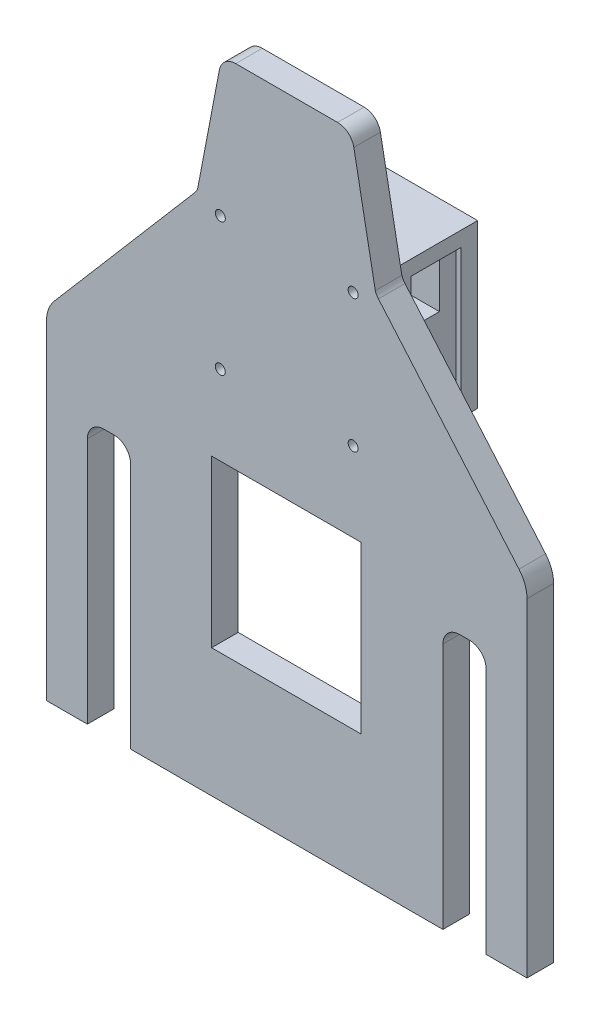
from build123d import *

# Parameters (mm, degrees)
BOSS_EXTRUDE1_DEPTH    = 8
SKETCH2_W              = 45
SKETCH2_H              = 50
CUT_EXTRUDE1_DEPTH     = 342.206659287
SPLIT1_SURFACE_1_BACK  = 343.199
SPLIT1_SURFACE_1_DEPTH = 686.398
SPLIT1_SURFACE_2_BACK  = 343.199
SPLIT1_SURFACE_2_DEPTH = 686.398
SKETCH5_R              = 2.5
CUT_EXTRUDE6_DEPTH     = 5.2
SKETCH4_R              = 2.5
CUT_EXTRUDE7_DEPTH     = 10
SKETCH6_R              = 1.5
CUT_EXTRUDE8_DEPTH     = 342.206659287
SKETCH7_W              = 49
SKETCH7_H              = 49
SKETCH7_W_2            = 18
SKETCH7_H_2            = 18
BOSS_EXTRUDE2_DEPTH    = 15
SKETCH8_W              = 49
SKETCH8_H              = 49
SKETCH8_R              = 1.5
BOSS_EXTRUDE3_DEPTH    = 10
SKETCH9_W              = 15
SKETCH9_H              = 40
CUT_EXTRUDE9_DEPTH     = 1.5
SKETCH11_W             = 15
SKETCH11_H             = 40
CUT_EXTRUDE10_DEPTH    = 1.5


with BuildPart() as part:
    # Sketch1 → Boss-Extrude1 (new body)
    with BuildSketch(Plane.XY):
        with BuildLine():
            Line((70, 309.985818768), (85.299227191, 309.985818768))
            ThreePointArc((85.299227191, 309.985818768), (88.489017574, 308.836174247), (90.211957942, 305.915913694))
            Line((90.211957942, 305.915913694), (96.672728921, 271.790334282))
            ThreePointArc((96.672728921, 271.790334282), (97.06575438, 270.906904614), (97.621470019, 270.115641625))
            Line((97.621470019, 270.115641625), (139.950460317, 220.786053348))
            ThreePointArc((139.950460317, 220.786053348), (141.739336996, 217.746026552), (142.361429131, 214.274017901))
            Line((142.361429131, 214.274017901), (142.361429131, 30.859943174))
            ThreePointArc((142.361429131, 30.859943174), (140.896963037, 27.324409268), (137.361429131, 25.859943174))
            Line((137.361429131, 25.859943174), (114.717190871, 25.782318449))
            ThreePointArc((114.717190871, 25.782318449), (112.681998989, 25.341726514), (111.002773989, 24.110332733))
            Line((111.002773989, 24.110332733), (89.38285929, 0))
            Line((89.38285929, 0), (50.5, 0))
            Line((50.5, 0), (28.997226011, 24.110332733))
            ThreePointArc((28.997226011, 24.110332733), (27.318001011, 25.341726514), (25.282809129, 25.782318449))
            Line((25.282809129, 25.782318449), (2.638570869, 25.859943174))
            ThreePointArc((2.638570869, 25.859943174), (-0.896963037, 27.324409268), (-2.361429131, 30.859943174))
            Line((-2.361429131, 30.859943174), (-2.361429131, 214.274017901))
            ThreePointArc((-2.361429131, 214.274017901), (-1.739336996, 217.746026552), (0.049539683, 220.786053348))
            Line((0.049539683, 220.786053348), (42.261389271, 270.115641625))
            ThreePointArc((42.261389271, 270.115641625), (42.81710491, 270.906904614), (43.210130369, 271.790334282))
            Line((43.210130369, 271.790334282), (49.724618218, 305.923183314))
            ThreePointArc((49.724618218, 305.923183314), (51.449026762, 308.838533573), (54.635967087, 309.985818768))
            Line((54.635967087, 309.985818768), (70, 309.985818768))
        make_face()
        with BuildLine():
            Line((15.218798766, 54.807228462), (17.702103505, 54.807228462))
            ThreePointArc((17.702103505, 54.807228462), (21.420312934, 56.347361236), (22.960445707, 60.065570665))
            Line((22.960445707, 60.065570665), (22.960445707, 189.807228462))
            ThreePointArc((22.960445707, 189.807228462), (21.495979613, 193.342762368), (17.960445707, 194.807228462))
            Line((17.960445707, 194.807228462), (14.960456564, 194.807228462))
            ThreePointArc((14.960456564, 194.807228462), (11.424922658, 193.342762368), (9.960456564, 189.807228462))
            Line((9.960456564, 189.807228462), (9.960456564, 60.065570665))
            ThreePointArc((9.960456564, 60.065570665), (11.500589337, 56.347361236), (15.218798766, 54.807228462))
        make_face(mode=Mode.SUBTRACT)
        with BuildLine():
            Line((125.039543436, 54.807228462), (122.039554293, 54.807228462))
            ThreePointArc((122.039554293, 54.807228462), (118.504020387, 56.271694556), (117.039554293, 59.807228462))
            Line((117.039554293, 59.807228462), (117.039554293, 189.807228462))
            ThreePointArc((117.039554293, 189.807228462), (118.504020387, 193.342762368), (122.039554293, 194.807228462))
            Line((122.039554293, 194.807228462), (125.039543436, 194.807228462))
            ThreePointArc((125.039543436, 194.807228462), (128.575077342, 193.342762368), (130.039543436, 189.807228462))
            Line((130.039543436, 189.807228462), (130.039543436, 59.807228462))
            ThreePointArc((130.039543436, 59.807228462), (128.575077342, 56.271694556), (125.039543436, 54.807228462))
        make_face(mode=Mode.SUBTRACT)
    extrude(amount=BOSS_EXTRUDE1_DEPTH)

    # Sketch2 → Cut-Extrude1 (cut, through all)
    with BuildSketch(Plane.XY.offset(8)):
        with Locations((69.88285929, 179.008918923)):
            Rectangle(SKETCH2_W, SKETCH2_H)
    extrude(amount=-CUT_EXTRUDE1_DEPTH, mode=Mode.SUBTRACT)


with BuildPart() as body_2:
    # Split1: the piece behind the surface
    add(part.part)
    # Split1 surface: a surface, the sketch's curves swept straight by 686.398 mm
    with BuildLine(Plane(origin=(0, 0, 0), x_dir=(-1, 0, 0), z_dir=(0, 0, -1)).offset(-SPLIT1_SURFACE_1_BACK), mode=Mode.PRIVATE) as split1_surface_1_path:
        Line((-142.361429131, 115.359943174), (2.361429131, 115.359943174))
    split1_surface_1 = Shell.extrude(split1_surface_1_path.wire(), (0 * SPLIT1_SURFACE_1_DEPTH, 0 * SPLIT1_SURFACE_1_DEPTH, -1 * SPLIT1_SURFACE_1_DEPTH))
    split(bisect_by=split1_surface_1, keep=Keep.BOTTOM)

    # Sketch5 → Cut-Extrude6 (cut)
    with BuildSketch(Plane(origin=(0, 115.359943174, -115.359943174), x_dir=(1, 0, 0), z_dir=(0, -1, 0))):
        with Locations((70, 119.359943174)):
            Circle(SKETCH5_R)
        with Locations((40, 119.359943174)):
            Circle(SKETCH5_R)
        with Locations((2.638570869, 119.359943174)):
            Circle(SKETCH5_R)
    extrude(amount=CUT_EXTRUDE6_DEPTH, mode=Mode.SUBTRACT)


with BuildPart() as part_1:
    add(part.part)

    # Split1: split by a surface, the side it looks to stays
    # Split1 surface: a surface, the sketch's curves swept straight by 686.398 mm
    with BuildLine(Plane(origin=(0, 0, 0), x_dir=(-1, 0, 0), z_dir=(0, 0, -1)).offset(-SPLIT1_SURFACE_2_BACK), mode=Mode.PRIVATE) as split1_surface_2_path:
        Line((-142.361429131, 115.359943174), (2.361429131, 115.359943174))
    split1_surface_2 = Shell.extrude(split1_surface_2_path.wire(), (0 * SPLIT1_SURFACE_2_DEPTH, 0 * SPLIT1_SURFACE_2_DEPTH, -1 * SPLIT1_SURFACE_2_DEPTH))
    split(bisect_by=split1_surface_2, keep=Keep.TOP)

    # Sketch4 → Cut-Extrude7 (cut)
    with BuildSketch(Plane(origin=(0, 115.359943174, 0), x_dir=(-1, 0, 0), z_dir=(0, -1, 0))):
        with Locations((-70, -4)):
            Circle(SKETCH4_R)
        with Locations((-40, -4)):
            Circle(SKETCH4_R)
        with Locations((-100, -4)):
            Circle(SKETCH4_R)
        with Locations((-137.361429131, -4)):
            Circle(SKETCH4_R)
        with Locations((-3.799513716, -4)):
            Circle(SKETCH4_R)
    extrude(amount=-CUT_EXTRUDE7_DEPTH, mode=Mode.SUBTRACT)

    # Sketch6 → Cut-Extrude8 (cut, through all)
    with BuildSketch(Plane.XY.offset(8)):
        with Locations((50.000130369, 267.980334282)):
            Circle(SKETCH6_R)
        with Locations((90.000130369, 267.980334282)):
            Circle(SKETCH6_R)
        with Locations((90.000130369, 227.980334282)):
            Circle(SKETCH6_R)
        with Locations((50.000130369, 227.980334282)):
            Circle(SKETCH6_R)
    extrude(amount=-CUT_EXTRUDE8_DEPTH, mode=Mode.SUBTRACT)

    # Sketch7 → Boss-Extrude2 (add)
    with BuildSketch(Plane(origin=(0, 0, 0), x_dir=(-1, 0, 0), z_dir=(0, 0, -1))):
        with Locations((-70.000130369, 247.980334282)):
            Rectangle(SKETCH7_W, SKETCH7_H)
        with Locations((-56.000130369, 261.980334282)):
            Rectangle(SKETCH7_W_2, SKETCH7_H_2, mode=Mode.SUBTRACT)
        with Locations((-84.000130369, 261.980334282)):
            Rectangle(SKETCH7_W_2, SKETCH7_H_2, mode=Mode.SUBTRACT)
        with Locations((-84.000130369, 233.980334282)):
            Rectangle(SKETCH7_W_2, SKETCH7_H_2, mode=Mode.SUBTRACT)
        with Locations((-56.000130369, 233.980334282)):
            Rectangle(SKETCH7_W_2, SKETCH7_H_2, mode=Mode.SUBTRACT)
    extrude(amount=BOSS_EXTRUDE2_DEPTH)

    # Sketch8 → Boss-Extrude3 (add)
    with BuildSketch(Plane(origin=(0, 0, -15), x_dir=(-1, 0, 0), z_dir=(0, 0, -1))):
        with Locations((-70.000130369, 247.980334282)):
            Rectangle(SKETCH8_W, SKETCH8_H)
        with Locations((-50.000130369, 267.980334282)):
            Circle(SKETCH8_R, mode=Mode.SUBTRACT)
        with Locations((-90.000130369, 267.980334282)):
            Circle(SKETCH8_R, mode=Mode.SUBTRACT)
        with Locations((-50.000130369, 227.980334282)):
            Circle(SKETCH8_R, mode=Mode.SUBTRACT)
        with Locations((-90.000130369, 227.980334282)):
            Circle(SKETCH8_R, mode=Mode.SUBTRACT)
    extrude(amount=BOSS_EXTRUDE3_DEPTH)

    # Sketch9 → Cut-Extrude9 (cut)
    with BuildSketch(Plane.ZY.offset(-45.500130369)):
        with Locations((-12.5, 247.980334282)):
            Rectangle(SKETCH9_W, SKETCH9_H)
    extrude(amount=-CUT_EXTRUDE9_DEPTH, mode=Mode.SUBTRACT)

    # Sketch11 → Cut-Extrude10 (cut)
    with BuildSketch(Plane(origin=(94.500130369, 0, 0), x_dir=(0, 0, -1), z_dir=(1, 0, 0))):
        with Locations((12.5, 247.980334282)):
            Rectangle(SKETCH11_W, SKETCH11_H)
    extrude(amount=-CUT_EXTRUDE10_DEPTH, mode=Mode.SUBTRACT)


solid = part_1.part
